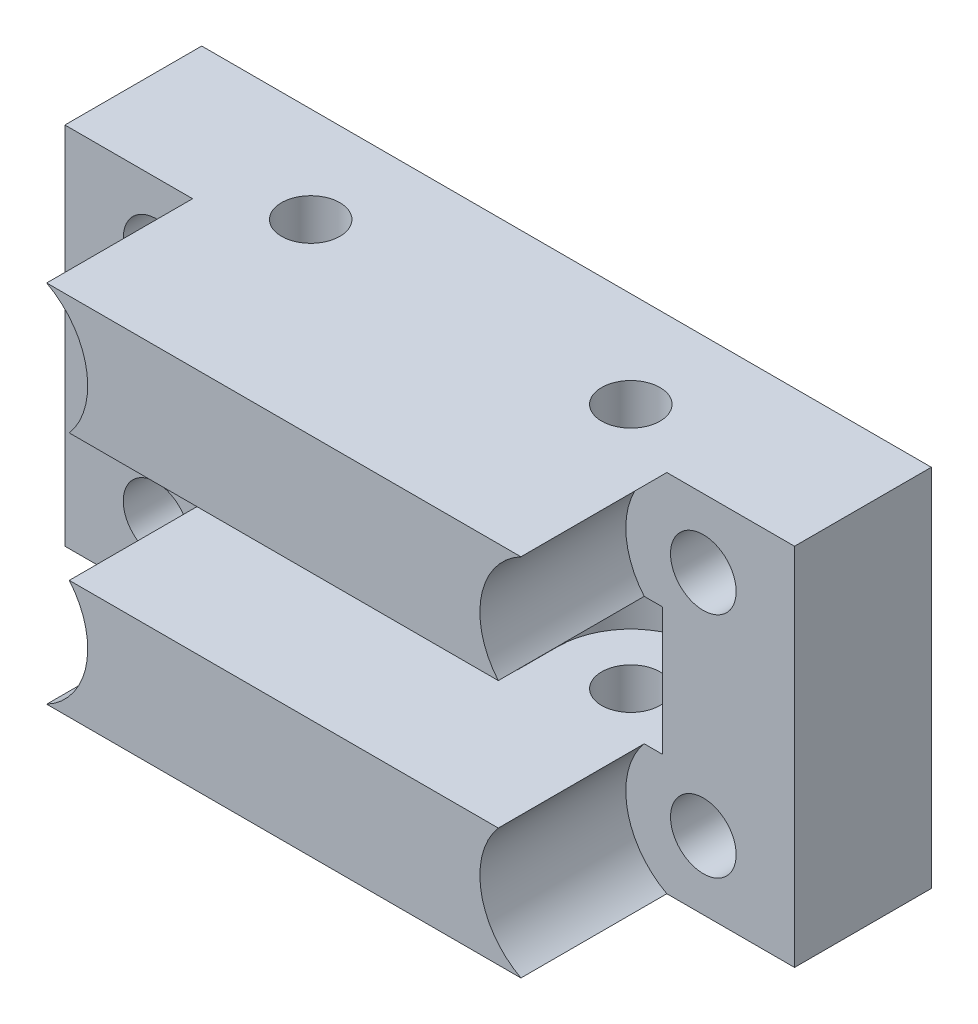
from build123d import *

# Parameters (mm, degrees)
SKETCH1_W               = 50.8
SKETCH1_H               = 25.4
BOSS_EXTRUDE1_DEPTH     = 4.7625
SKETCH2_R               = 2.286
CUT_EXTRUDE1_DEPTH      = 30.952890094
CUT_EXTRUDE2_DEPTH      = 4.445
SKETCH5_R               = 2.032
CUT_EXTRUDE3_DEPTH      = 37.235361268
BOSS_EXTRUDE2_DEPTH     = 10.16
MIRROR2_COPY_1_SKETCH_R = 2.286
MIRROR2_COPY_1_DEPTH    = 30.952890094
MIRROR2_COPY_2_DEPTH    = 10.16
MIRROR2_COPY_3_SKETCH_R = 2.286
MIRROR2_COPY_3_DEPTH    = 30.952890094
MIRROR2_COPY_4_DEPTH    = 10.16


with BuildPart() as part:
    # Sketch1 → Boss-Extrude1 (new, symmetric)
    with BuildSketch(Plane.XY):
        Rectangle(SKETCH1_W, SKETCH1_H)
    extrude(amount=BOSS_EXTRUDE1_DEPTH, both=True)

    # Sketch2 → Cut-Extrude1 (cut, through all)
    with BuildSketch(Plane.XY.offset(4.7625)):
        with Locations((-19.05, 7.9375)):
            Circle(SKETCH2_R)
    cut_extrude1 = extrude(amount=-CUT_EXTRUDE1_DEPTH, mode=Mode.SUBTRACT)

    # Sketch4 → Cut-Extrude2 (cut, symmetric)
    with BuildSketch(Plane(origin=(0, 0, 0), x_dir=(1, 0, 0), z_dir=(0, 1, 0))):
        with BuildLine():
            Line((-16.22425, -1.905), (-16.22425, -4.7625))
            Line((-16.22425, -4.7625), (-6.06425, -4.7625))
            Line((-6.06425, -4.7625), (-6.06425, -1.905))
            ThreePointArc((-6.06425, -1.905), (-11.14425, 3.175), (-16.22425, -1.905))
        make_face()
    cut_extrude2 = extrude(amount=CUT_EXTRUDE2_DEPTH, both=True, mode=Mode.SUBTRACT)

    # Sketch5 → Cut-Extrude3 (cut, through all)
    with BuildSketch(Plane(origin=(0, 12.7, 0), x_dir=(1, 0, 0), z_dir=(0, 1, 0))):
        with Locations((-11.14425, -1.905)):
            Circle(SKETCH5_R)
    cut_extrude3 = extrude(amount=-CUT_EXTRUDE3_DEPTH, mode=Mode.SUBTRACT)

    # Sketch6 → Boss-Extrude2 (add)
    with BuildSketch(Plane.XY.offset(4.7625)):
        with BuildLine():
            Line((-16.51, 12.7), (16.51, 12.7))
            ThreePointArc((16.51, 12.7), (13.748168987, 8.949228305), (14.934729657, 4.445))
            Line((14.934729657, 4.445), (-14.934729657, 4.445))
            ThreePointArc((-14.934729657, 4.445), (-13.748168987, 8.949228305), (-16.51, 12.7))
        make_face()
    boss_extrude2 = extrude(amount=BOSS_EXTRUDE2_DEPTH)

    # Mirror1: Cut-Extrude1, Boss-Extrude2 across plane
    add(cut_extrude1.mirror(Plane.ZX), mode=Mode.SUBTRACT)
    add(boss_extrude2.mirror(Plane.ZX))

    # Mirror2: Cut-Extrude2, Cut-Extrude3 across plane
    add(cut_extrude2.mirror(Plane(origin=(0, 0, 0), x_dir=(0, 0, 1), z_dir=(1, 0, 0))), mode=Mode.SUBTRACT)
    add(cut_extrude3.mirror(Plane(origin=(0, 0, 0), x_dir=(0, 0, 1), z_dir=(1, 0, 0))), mode=Mode.SUBTRACT)

    # Mirror2 copy 1 sketch → Mirror2 copy 1 (cut, through all)
    with BuildSketch(Plane(origin=(0, 0, 4.7625), x_dir=(-1, 0, 0), z_dir=(0, 0, 1))):
        with Locations((-19.05, 7.9375)):
            Circle(MIRROR2_COPY_1_SKETCH_R)
    extrude(amount=-MIRROR2_COPY_1_DEPTH, mode=Mode.SUBTRACT)

    # Mirror2 copy 2 sketch → Mirror2 copy 2 (add)
    with BuildSketch(Plane(origin=(0, 0, 4.7625), x_dir=(-1, 0, 0), z_dir=(0, 0, 1))):
        with BuildLine():
            Line((-16.51, 12.7), (16.51, 12.7))
            ThreePointArc((16.51, 12.7), (13.748168987, 8.949228305), (14.934729657, 4.445))
            Line((14.934729657, 4.445), (-14.934729657, 4.445))
            ThreePointArc((-14.934729657, 4.445), (-13.748168987, 8.949228305), (-16.51, 12.7))
        make_face()
    extrude(amount=MIRROR2_COPY_2_DEPTH)

    # Mirror2 copy 3 sketch → Mirror2 copy 3 (cut, through all)
    with BuildSketch(Plane(origin=(0, 0, 4.7625), x_dir=(-1, 0, 0), z_dir=(0, 0, 1))):
        with Locations((-19.05, -7.9375)):
            Circle(MIRROR2_COPY_3_SKETCH_R)
    extrude(amount=-MIRROR2_COPY_3_DEPTH, mode=Mode.SUBTRACT)

    # Mirror2 copy 4 sketch → Mirror2 copy 4 (add)
    with BuildSketch(Plane(origin=(0, 0, 4.7625), x_dir=(-1, 0, 0), z_dir=(0, 0, 1))):
        with BuildLine():
            Line((-16.51, -12.7), (16.51, -12.7))
            ThreePointArc((16.51, -12.7), (13.748168987, -8.949228305), (14.934729657, -4.445))
            Line((14.934729657, -4.445), (-14.934729657, -4.445))
            ThreePointArc((-14.934729657, -4.445), (-13.748168987, -8.949228305), (-16.51, -12.7))
        make_face()
    extrude(amount=MIRROR2_COPY_4_DEPTH)


solid = part.part
